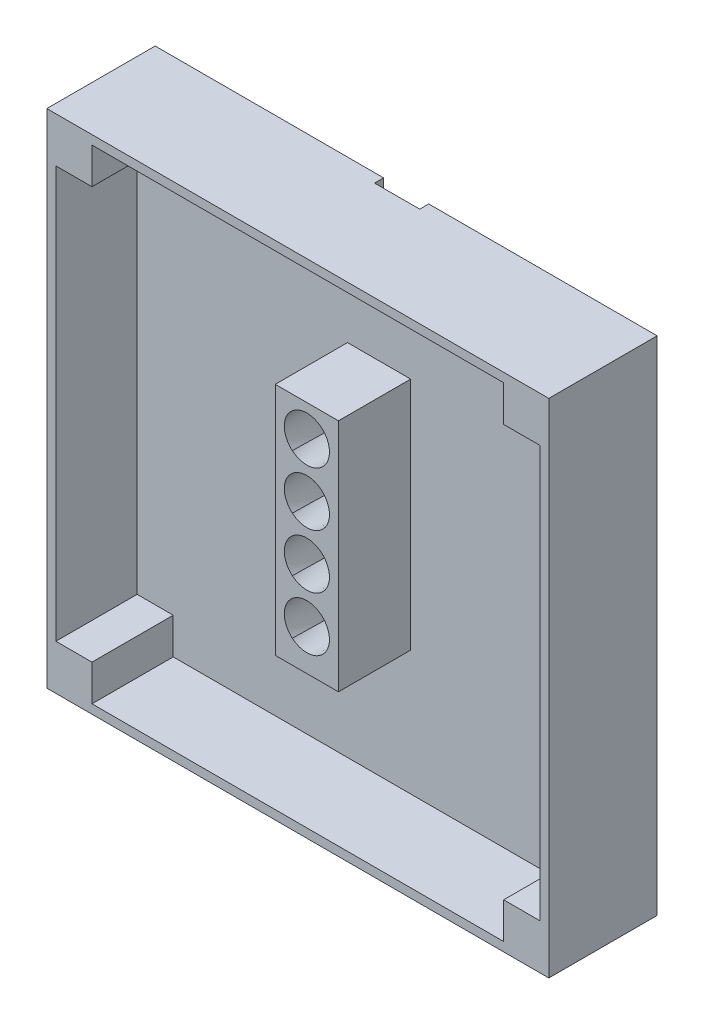
from build123d import *

# Parameters (mm, degrees)
SKICA1_W                 = 55.6
SKICA1_H                 = 55.6
P_IDAT_VYSUNUT_M1_DEPTH  = 3
SKICA2_W                 = 5
SKICA2_H                 = 55.6
ODEBRAT_VYSUNUT_M1_DEPTH = 1
SKICA3_R                 = 2
SKICA3_W                 = 1
SKICA3_H                 = 24
ODEBRAT_VYSUNUT_M2_DEPTH = 1.4
SKICA4_W                 = 7
SKICA4_H                 = 26
P_IDAT_VYSUNUT_M2_DEPTH  = 8
LINPOLE1_COUNT           = 4
LINPOLE1_PITCH           = 6
SKICA9_W                 = 54.6
SKICA9_H                 = 1
SKICA9_W_2               = 1
SKICA9_H_2               = 53.6
SKICA9_W_3               = 4
SKICA9_H_3               = 4
P_IDAT_VYSUNUT_M3_DEPTH  = 9


with BuildPart() as part:
    # Skica1 → Přidat vysunutím1 (new body)
    with BuildSketch(Plane.XY):
        Rectangle(SKICA1_W, SKICA1_H)
    extrude(amount=P_IDAT_VYSUNUT_M1_DEPTH)

    # Skica2 → Odebrat vysunutím1 (cut)
    with BuildSketch(Plane(origin=(0, 0, 0), x_dir=(-1, 0, 0), z_dir=(0, 0, -1))):
        Rectangle(SKICA2_W, SKICA2_H)
    extrude(amount=-ODEBRAT_VYSUNUT_M1_DEPTH, mode=Mode.SUBTRACT)

    # Skica3 → Odebrat vysunutím2 (cut)
    with BuildSketch(Plane(origin=(0, 0, 1), x_dir=(-1, 0, 0), z_dir=(0, 0, -1))):
        with Locations((0, 20.8)):
            Circle(SKICA3_R)
        with Locations((0, -20.8)):
            Circle(SKICA3_R)
        Rectangle(SKICA3_W, SKICA3_H)
    extrude(amount=-ODEBRAT_VYSUNUT_M2_DEPTH, mode=Mode.SUBTRACT)

    # Skica4 → Přidat vysunutím2 (add)
    with BuildSketch(Plane.XY.offset(3)):
        Rectangle(SKICA4_W, SKICA4_H)
    extrude(amount=P_IDAT_VYSUNUT_M2_DEPTH)

    # Odebrat spojením profilů2: read off the stored shape, not the designer's step
    # Odebrat spojením profilů2: loft between two sections, ruled curve by curve
    odebrat_spojen_m_profil_2_from = [
        Edge.make_bspline([(-2.5, 6.525099132, 2), (-2.083333333, 6.525099132, 2), (-1.666666667, 6.525099132, 2), (-0.833333333, 6.525099132, 2), (-0.416666667, 6.525099132, 2), (0.416666667, 6.525099132, 2), (0.833333333, 6.525099132, 2), (1.666666667, 6.525099132, 2), (2.083333333, 6.525099132, 2), (2.5, 6.525099132, 2)], [0, 0, 0, 0, 0.25, 0.25, 0.5, 0.5, 0.75, 0.75, 1, 1, 1, 1], 3),
        Edge.make_bspline([(-2.5, 12.474900868, 2), (-2.5, 11.979084057, 2), (-2.5, 11.483267245, 2), (-2.5, 10.491633623, 2), (-2.5, 9.995816811, 2), (-2.5, 9.004183189, 2), (-2.5, 8.508366377, 2), (-2.5, 7.516732755, 2), (-2.5, 7.020915943, 2), (-2.5, 6.525099132, 2)], [0, 0, 0, 0, 0.25, 0.25, 0.5, 0.5, 0.75, 0.75, 1, 1, 1, 1], 3),
        Edge.make_bspline([(2.5, 12.474900868, 2), (2.083333333, 12.474900868, 2), (1.666666667, 12.474900868, 2), (0.833333333, 12.474900868, 2), (0.416666667, 12.474900868, 2), (-0.416666667, 12.474900868, 2), (-0.833333333, 12.474900868, 2), (-1.666666667, 12.474900868, 2), (-2.083333333, 12.474900868, 2), (-2.5, 12.474900868, 2)], [0, 0, 0, 0, 0.25, 0.25, 0.5, 0.5, 0.75, 0.75, 1, 1, 1, 1], 3),
        Edge.make_bspline([(2.5, 6.525099132, 2), (2.5, 7.020915943, 2), (2.5, 7.516732755, 2), (2.5, 8.508366377, 2), (2.5, 9.004183189, 2), (2.5, 9.995816811, 2), (2.5, 10.491633623, 2), (2.5, 11.483267245, 2), (2.5, 11.979084057, 2), (2.5, 12.474900868, 2)], [0, 0, 0, 0, 0.25, 0.25, 0.5, 0.5, 0.75, 0.75, 1, 1, 1, 1], 3),
    ]
    odebrat_spojen_m_profil_2_to = [
        Edge.make_bspline([(-1.608388791, 7.586081116, 11), (-1.403167079, 7.413620149, 11), (-1.156724267, 7.264297071, 11), (-0.606690103, 7.056988388, 11), (-0.303658501, 7, 11), (0.303658501, 7, 11), (0.606690103, 7.056988388, 11), (1.156724267, 7.264297071, 11), (1.403167079, 7.413620149, 11), (1.608388791, 7.586081116, 11)], [0, 0, 0, 0, 0.25, 0.25, 0.5, 0.5, 0.75, 0.75, 1, 1, 1, 1], 3),
        Edge.make_bspline([(-1.608388791, 11.413918884, 11), (-1.852594491, 11.208697172, 11), (-2.079966955, 10.935038102, 11), (-2.405399483, 10.274370851, 11), (-2.5, 9.8882136, 11), (-2.5, 9.1117864, 11), (-2.405399483, 8.725629149, 11), (-2.079966955, 8.064961898, 11), (-1.852594491, 7.791302828, 11), (-1.608388791, 7.586081116, 11)], [0, 0, 0, 0, 0.25, 0.25, 0.5, 0.5, 0.75, 0.75, 1, 1, 1, 1], 3),
        Edge.make_bspline([(1.608388791, 11.413918884, 11), (1.403167079, 11.586379851, 11), (1.156724267, 11.735702929, 11), (0.606690103, 11.943011612, 11), (0.303658501, 12, 11), (-0.303658501, 12, 11), (-0.606690103, 11.943011612, 11), (-1.156724267, 11.735702929, 11), (-1.403167079, 11.586379851, 11), (-1.608388791, 11.413918884, 11)], [0, 0, 0, 0, 0.25, 0.25, 0.5, 0.5, 0.75, 0.75, 1, 1, 1, 1], 3),
        Edge.make_bspline([(1.608388791, 7.586081116, 11), (1.852594491, 7.791302828, 11), (2.079966955, 8.064961898, 11), (2.405399483, 8.725629149, 11), (2.5, 9.1117864, 11), (2.5, 9.8882136, 11), (2.405399483, 10.274370851, 11), (2.079966955, 10.935038102, 11), (1.852594491, 11.208697172, 11), (1.608388791, 11.413918884, 11)], [0, 0, 0, 0, 0.25, 0.25, 0.5, 0.5, 0.75, 0.75, 1, 1, 1, 1], 3),
    ]
    odebrat_spojen_m_profil_2 = Solid(Shell([*[Face.make_surface_from_curves(odebrat_spojen_m_profil_2_from[k], odebrat_spojen_m_profil_2_to[k]) for k in range(4)], Face(Wire(odebrat_spojen_m_profil_2_from)), Face(Wire(odebrat_spojen_m_profil_2_to))]))
    add(odebrat_spojen_m_profil_2, mode=Mode.SUBTRACT)

    # LinPole1: Odebrat spojením profilů2 ×4
    with Locations(*[(0, -i * LINPOLE1_PITCH, 0) for i in range(1, LINPOLE1_COUNT)]):
        add(odebrat_spojen_m_profil_2, mode=Mode.SUBTRACT)

    # Skica9 → Přidat vysunutím3 (add)
    with BuildSketch(Plane.XY.offset(3)):
        Polygon((-26.8, 22.8), (-26.8, 26.8), (-26.8, 27.8), (-27.8, 27.8), (-27.8, -27.8), (-26.8, -27.8), (-26.8, -26.8), (-26.8, -22.8), align=None)
        Polygon((22.8, 26.8), (26.8, 26.8), (27.8, 26.8), (27.8, 27.8), (-26.8, 27.8), (-26.8, 26.8), (-22.8, 26.8), align=None)
        with Locations((0.5, -27.3)):
            Rectangle(SKICA9_W, SKICA9_H)
        with Locations((27.3, 0)):
            Rectangle(SKICA9_W_2, SKICA9_H_2)
        with Locations((-24.8, 24.8)):
            Rectangle(SKICA9_W_3, SKICA9_H_3)
        with Locations((24.8, 24.8)):
            Rectangle(SKICA9_W_3, SKICA9_H_3)
        with Locations((24.8, -24.8)):
            Rectangle(SKICA9_W_3, SKICA9_H_3)
        with Locations((-24.8, -24.8)):
            Rectangle(SKICA9_W_3, SKICA9_H_3)
    extrude(amount=P_IDAT_VYSUNUT_M3_DEPTH)


solid = part.part
